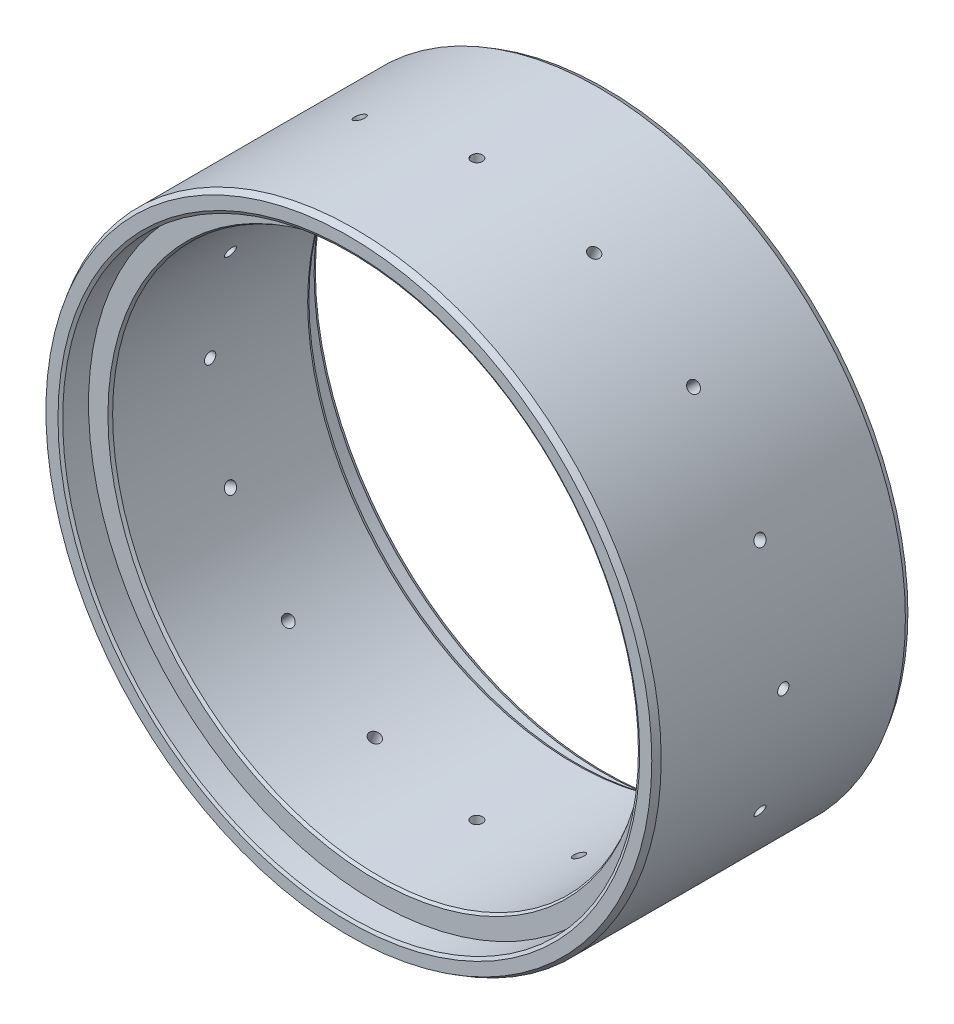
from build123d import *
from OCP.BRepFilletAPI import BRepFilletAPI_MakeChamfer

# Parameters (mm, degrees)
SKETCH1_R         = 67.7545
SKETCH1_R_2       = 58.9915
EXTRUDE1_DEPTH    = 28.321
SKETCH11_R        = 63.66002
EXTRUDE2_DEPTH    = 6.096
CIRPATTERN1_COUNT = 16
CHAMFER1_SIZE     = 0.381
CHAMFER1_SIZE2    = 0.659911358
CHAMFER3_SIZE     = 0.762
CHAMFER3_SIZE2    = 1.319822715


with BuildPart() as part:
    # Sketch1 → Extrude1 (new, symmetric)
    with BuildSketch(Plane.XY):
        Circle(SKETCH1_R)
        Circle(SKETCH1_R_2, mode=Mode.SUBTRACT)
    extrude(amount=EXTRUDE1_DEPTH, both=True)

    # Sketch11 → Extrude2 (cut)
    with BuildSketch(Plane(origin=(0, 0, -28.321), x_dir=(-1, 0, 0), z_dir=(0, 0, -1))):
        Circle(SKETCH11_R)
    extrude2 = extrude(amount=-EXTRUDE2_DEPTH, mode=Mode.SUBTRACT)

    # Mirror1: Extrude2 across plane
    add(extrude2.mirror(Plane.XY), mode=Mode.SUBTRACT)

    # Sketch4 → Tap Drill for M3x0.5 Tap1 (revolve, cut)
    with BuildSketch(Plane(origin=(0, 67.7545, 0), x_dir=(0, 0, 1), z_dir=(1, 0, 0))):
        Polygon((0, 0), (0, 10.911075774), (1.25, 10.16), (1.25, 0), align=None)
    tap_drill_for_m3x0_5_tap1 = revolve(axis=Axis((0, 74.1045, 0), (0, -1, 0)), mode=Mode.SUBTRACT)

    # CirPattern1: Tap Drill for M3x0.5 Tap1 ×16 about axis
    cirpattern1_axis = Axis((0, 0, 28.321), (0, 0, -1))
    for i in range(1, CIRPATTERN1_COUNT):
        add(tap_drill_for_m3x0_5_tap1.rotate(cirpattern1_axis, i * 360 / CIRPATTERN1_COUNT), mode=Mode.SUBTRACT)

    # Chamfer1: one chamfer whose edges measure the first distance from different faces: ONE call of the kernel's chamfer builder (chamfer() names one face for all edges)
    chamfer1_edges_1 = [part.edges().sort_by_distance(p)[0] for p in [
        (-58.9915, 0, -22.225),
    ]]
    chamfer1_side_1 = [part.faces().sort_by_distance(p)[0] for p in [
        (61.859442727, 0, -22.225),
    ]]
    chamfer1_edges_2 = [part.edges().sort_by_distance(p)[0] for p in [
        (63.66002, 0, 28.321),
    ]]
    chamfer1_side_2 = [part.faces().sort_by_distance(p)[0] for p in [
        (63.66002, 0, 25.273),
    ]]
    chamfer1_edges_3 = [part.edges().sort_by_distance(p)[0] for p in [
        (-58.9915, 0, 22.225),
    ]]
    chamfer1_side_3 = [part.faces().sort_by_distance(p)[0] for p in [
        (61.859442727, 0, 22.225),
    ]]
    chamfer1_edges_4 = [part.edges().sort_by_distance(p)[0] for p in [
        (63.66002, 0, -28.321),
    ]]
    chamfer1_side_4 = [part.faces().sort_by_distance(p)[0] for p in [
        (-65.838113344, 0, -28.321),
    ]]
    chamfer1 = BRepFilletAPI_MakeChamfer(part.part.solid().wrapped)
    for e in chamfer1_edges_1:
        chamfer1.Add(CHAMFER1_SIZE, CHAMFER1_SIZE2, e.wrapped, chamfer1_side_1[0].wrapped)  # the first distance lies on this face
    for e in chamfer1_edges_2:
        chamfer1.Add(CHAMFER1_SIZE, CHAMFER1_SIZE2, e.wrapped, chamfer1_side_2[0].wrapped)  # the first distance lies on this face
    for e in chamfer1_edges_3:
        chamfer1.Add(CHAMFER1_SIZE, CHAMFER1_SIZE2, e.wrapped, chamfer1_side_3[0].wrapped)  # the first distance lies on this face
    for e in chamfer1_edges_4:
        chamfer1.Add(CHAMFER1_SIZE, CHAMFER1_SIZE2, e.wrapped, chamfer1_side_4[0].wrapped)  # the first distance lies on this face
    add(Compound.cast(chamfer1.Shape()), mode=Mode.REPLACE)

    # Chamfer3: one chamfer whose edges measure the first distance from different faces: ONE call of the kernel's chamfer builder (chamfer() names one face for all edges)
    chamfer3_edges_1 = [part.edges().sort_by_distance(p)[0] for p in [
        (-67.7545, 0, 28.321),
    ]]
    chamfer3_side_1 = [part.faces().sort_by_distance(p)[0] for p in [
        (66.236318014, 0, 28.321),
    ]]
    chamfer3_edges_2 = [part.edges().sort_by_distance(p)[0] for p in [
        (-67.7545, 0, -28.321),
    ]]
    chamfer3_side_2 = [part.faces().sort_by_distance(p)[0] for p in [
        (65.957406656, 0, -28.321),
    ]]
    chamfer3 = BRepFilletAPI_MakeChamfer(part.part.solid().wrapped)
    for e in chamfer3_edges_1:
        chamfer3.Add(CHAMFER3_SIZE, CHAMFER3_SIZE2, e.wrapped, chamfer3_side_1[0].wrapped)  # the first distance lies on this face
    for e in chamfer3_edges_2:
        chamfer3.Add(CHAMFER3_SIZE, CHAMFER3_SIZE2, e.wrapped, chamfer3_side_2[0].wrapped)  # the first distance lies on this face
    add(Compound.cast(chamfer3.Shape()), mode=Mode.REPLACE)


solid = part.part
